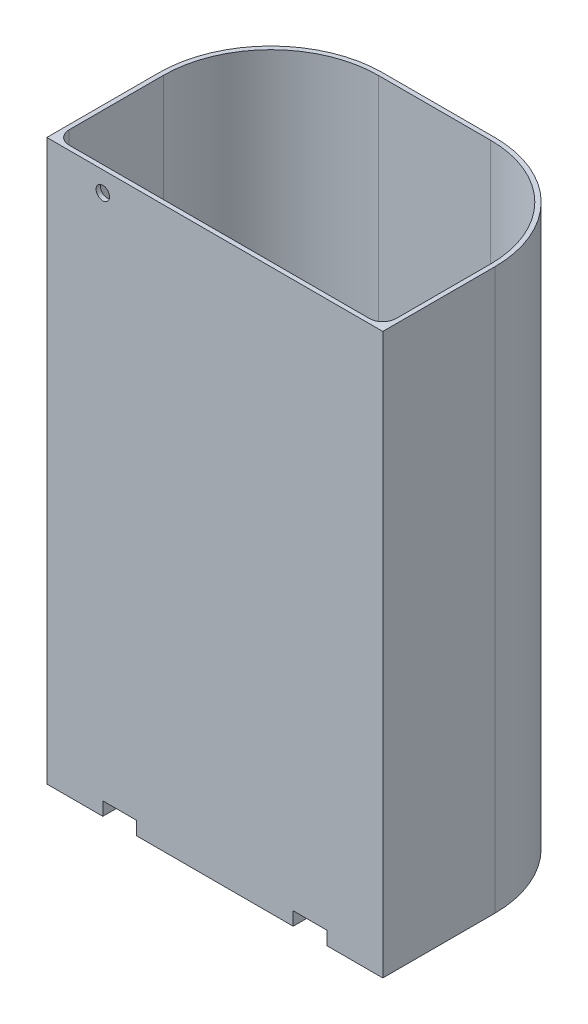
from build123d import *
from OCP.BRepFilletAPI import BRepFilletAPI_MakeChamfer

# Parameters (mm, degrees)
SKETCH1_W           = 150
SKETCH1_H           = 100
BOSS_EXTRUDE1_DEPTH = 250
FILLET1_R           = 50
SKETCH4_W           = 15
SKETCH4_H           = 60
CUT_EXTRUDE2_DEPTH  = 6
SKETCH5_W           = 15
SKETCH5_H           = 8
CUT_EXTRUDE3_DEPTH  = 4
CHAMFER2_SIZE       = 2
CHAMFER2_SIZE2      = 3.464101615
SHELL1_START        = 42
SHELL1_OUTLINE_W    = 248
SHELL1_OUTLINE_H    = 96
SHELL1_DEPTH        = 66
SHELL1_START_2      = 2
SHELL1_2_DEPTH      = 40
SHELL1_START_3      = 108
SHELL1_3_DEPTH      = 40
SHELL1_4_DEPTH      = 21
SHELL1_START_4      = 127
SHELL1_5_DEPTH      = 21
SHELL1_6_DEPTH      = 250
FILLET4_R           = 6
SKETCH6_W           = 10
SKETCH6_H           = 3
EXTRUDE_THIN1_DEPTH = 9.5
FILLET5_R           = 3
CUT_EXTRUDE4_REACH  = 304.212
SKETCH7_R           = 3
FILLET6_R           = 0.5
SKETCH8_R           = 3
CUT_EXTRUDE5_DEPTH  = 10


with BuildPart() as part:
    # Sketch1 → Boss-Extrude1 (new body)
    with BuildSketch(Plane(origin=(0, 0, 0), x_dir=(1, 0, 0), z_dir=(0, 1, 0))):
        with Locations((75, 50)):
            Rectangle(SKETCH1_W, SKETCH1_H)
    extrude(amount=BOSS_EXTRUDE1_DEPTH)

    # Fillet1
    fillet1_edges = [part.edges().sort_by_distance(p)[0] for p in [
        (0, 125, -100),
        (150, 125, -100),
    ]]
    fillet(fillet1_edges, radius=FILLET1_R)

    # Sketch4 → Cut-Extrude2 (cut)
    with BuildSketch(Plane.XZ):
        with Locations((32.5, -30)):
            Rectangle(SKETCH4_W, SKETCH4_H)
        with Locations((117.5, -30)):
            Rectangle(SKETCH4_W, SKETCH4_H)
    extrude(amount=-CUT_EXTRUDE2_DEPTH, mode=Mode.SUBTRACT)

    # Sketch5 → Cut-Extrude3 (cut)
    with BuildSketch(Plane.XZ.offset(-6)):
        with Locations((32.5, -12)):
            Rectangle(SKETCH5_W, SKETCH5_H)
        with Locations((117.5, -12)):
            Rectangle(SKETCH5_W, SKETCH5_H)
    extrude(amount=-CUT_EXTRUDE3_DEPTH, mode=Mode.SUBTRACT)

    # Chamfer2: one chamfer whose edges measure the first distance from different faces: ONE call of the kernel's chamfer builder (chamfer() names one face for all edges)
    chamfer2_edges_1 = [part.edges().sort_by_distance(p)[0] for p in [
        (32.5, 6, -16),
    ]]
    chamfer2_side_1 = [part.faces().sort_by_distance(p)[0] for p in [
        (32.5, 6, -38),
    ]]
    chamfer2_edges_2 = [part.edges().sort_by_distance(p)[0] for p in [
        (32.5, 6, -8),
    ]]
    chamfer2_side_2 = [part.faces().sort_by_distance(p)[0] for p in [
        (32.5, 6, -4),
    ]]
    chamfer2_edges_3 = [part.edges().sort_by_distance(p)[0] for p in [
        (117.5, 6, -16),
    ]]
    chamfer2_side_3 = [part.faces().sort_by_distance(p)[0] for p in [
        (117.5, 6, -38),
    ]]
    chamfer2_edges_4 = [part.edges().sort_by_distance(p)[0] for p in [
        (117.5, 6, -8),
    ]]
    chamfer2_side_4 = [part.faces().sort_by_distance(p)[0] for p in [
        (117.5, 6, -4),
    ]]
    chamfer2 = BRepFilletAPI_MakeChamfer(part.part.solid().wrapped)
    for e in chamfer2_edges_1:
        chamfer2.Add(CHAMFER2_SIZE, CHAMFER2_SIZE2, e.wrapped, chamfer2_side_1[0].wrapped)  # the first distance lies on this face
    for e in chamfer2_edges_2:
        chamfer2.Add(CHAMFER2_SIZE, CHAMFER2_SIZE2, e.wrapped, chamfer2_side_2[0].wrapped)  # the first distance lies on this face
    for e in chamfer2_edges_3:
        chamfer2.Add(CHAMFER2_SIZE, CHAMFER2_SIZE2, e.wrapped, chamfer2_side_3[0].wrapped)  # the first distance lies on this face
    for e in chamfer2_edges_4:
        chamfer2.Add(CHAMFER2_SIZE, CHAMFER2_SIZE2, e.wrapped, chamfer2_side_4[0].wrapped)  # the first distance lies on this face
    add(Compound.cast(chamfer2.Shape()), mode=Mode.REPLACE)

    # Shell1: read off the stored shape, not the designer's step
    # Shell1 outline → Shell1 (cut)
    with BuildSketch(Plane.YZ.offset(SHELL1_START)):
        with Locations((126, -50)):
            Rectangle(SHELL1_OUTLINE_W, SHELL1_OUTLINE_H)
    extrude(amount=SHELL1_DEPTH, mode=Mode.SUBTRACT)

    # Shell1 2 outline → Shell1 2 (cut)
    with BuildSketch(Plane.YZ.offset(SHELL1_START_2)):
        Polygon((8, -2), (8, -4.845299462), (10, -6), (12, -6), (12, -18), (10, -18), (8, -19.154700538), (8, -62), (2, -62), (2, -98), (250, -98), (250, -2), align=None)
    extrude(amount=SHELL1_2_DEPTH, mode=Mode.SUBTRACT)

    # Shell1 3 outline → Shell1 3 (cut)
    with BuildSketch(Plane.YZ.offset(SHELL1_START_3)):
        Polygon((8, -2), (8, -4.845299462), (10, -6), (12, -6), (12, -18), (10, -18), (8, -19.154700538), (8, -62), (2, -62), (2, -98), (250, -98), (250, -2), align=None)
    extrude(amount=SHELL1_3_DEPTH, mode=Mode.SUBTRACT)

    # Shell1 4 outline → Shell1 4 (cut)
    with BuildSketch(Plane.YZ.offset(SHELL1_START_2)):
        Polygon((10, -6), (8, -4.845299462), (8, -2), (2, -2), (2, -62), (8, -62), (8, -19.154700538), (10, -18), (12, -18), (12, -6), align=None)
    extrude(amount=SHELL1_4_DEPTH, mode=Mode.SUBTRACT)

    # Shell1 5 outline → Shell1 5 (cut)
    with BuildSketch(Plane.YZ.offset(SHELL1_START_4)):
        Polygon((10, -6), (8, -4.845299462), (8, -2), (2, -2), (2, -62), (8, -62), (8, -19.154700538), (10, -18), (12, -18), (12, -6), align=None)
    extrude(amount=SHELL1_5_DEPTH, mode=Mode.SUBTRACT)

    # Shell1 6 outline → Shell1 6 (add)
    with BuildSketch(Plane(origin=(0, 0, 0), x_dir=(1, 0, 0), z_dir=(0, 1, 0))):
        with BuildLine():
            Line((114, 98), (100, 98))
            ThreePointArc((100, 98), (133.941125497, 83.941125497), (148, 50))
            Line((148, 50), (148, 64))
            ThreePointArc((148, 64), (135.355339059, 85.355339059), (114, 98))
        make_face()
        with BuildLine():
            ThreePointArc((36, 98), (14.644660941, 85.355339059), (2, 64))
            Line((2, 64), (2, 50))
            ThreePointArc((2, 50), (16.058874503, 83.941125497), (50, 98))
            Line((50, 98), (36, 98))
        make_face()
    extrude(amount=SHELL1_6_DEPTH)

    # Fillet4
    fillet4_edges = [part.edges().sort_by_distance(p)[0] for p in [
        (12.5, 2, -2),
        (2, 2, -26),
        (16.058874503, 2, -83.941125497),
        (75, 2, -98),
        (133.941125497, 2, -83.941125497),
        (148, 2, -26),
        (137.5, 2, -2),
        (108, 2, -32),
        (127, 2, -32),
        (117.5, 2, -62),
        (75, 2, -2),
        (23, 2, -32),
        (42, 2, -32),
        (32.5, 2, -62),
        (2, 126, -2),
        (148, 126, -2),
    ]]
    fillet(fillet4_edges, radius=FILLET4_R - 0.0001)  # a hair under: the kernel refuses the full size

    # Sketch6 → Extrude-Thin1 (add)
    with BuildSketch(Plane(origin=(0, 2, 0), x_dir=(1, 0, 0), z_dir=(0, 1, 0))):
        with Locations((72, 81.075172512)):
            Rectangle(SKETCH6_W, SKETCH6_H)
    extrude(amount=EXTRUDE_THIN1_DEPTH)

    # Fillet5
    fillet5_edges = [part.edges().sort_by_distance(p)[0] for p in [
        (72, 2, -79.575172512),
        (67, 2, -81.075172512),
        (72, 2, -82.575172512),
        (77, 2, -81.075172512),
    ]]
    fillet(fillet5_edges, radius=FILLET5_R)

    # Sketch7 → Cut-Extrude4 (cut, up to next)
    with BuildSketch(Plane.XY.offset(-79.575172512), mode=Mode.PRIVATE) as cut_extrude4_sk1:
        with Locations((72, 9)):
            Circle(SKETCH7_R)
    cut_extrude4_tool1 = extrude(cut_extrude4_sk1.sketch, amount=-CUT_EXTRUDE4_REACH, mode=Mode.PRIVATE) & part.part
    add(cut_extrude4_tool1.solids().sort_by_distance((72, 9, -79.575173))[0], mode=Mode.SUBTRACT)

    # Fillet6
    fillet6_edges = [part.edges().sort_by_distance(p)[0] for p in [
        (73.658312395, 11.5, -81.075172512),
        (70.341687605, 11.5, -81.075172512),
    ]]
    fillet(fillet6_edges, radius=FILLET6_R)

    # Sketch8 → Cut-Extrude5 (cut)
    with BuildSketch(Plane(origin=(0, 0, -2), x_dir=(-1, 0, 0), z_dir=(0, 0, -1))):
        with Locations((-25, 241)):
            Circle(SKETCH8_R)
    extrude(amount=-CUT_EXTRUDE5_DEPTH, mode=Mode.SUBTRACT)


solid = part.part
